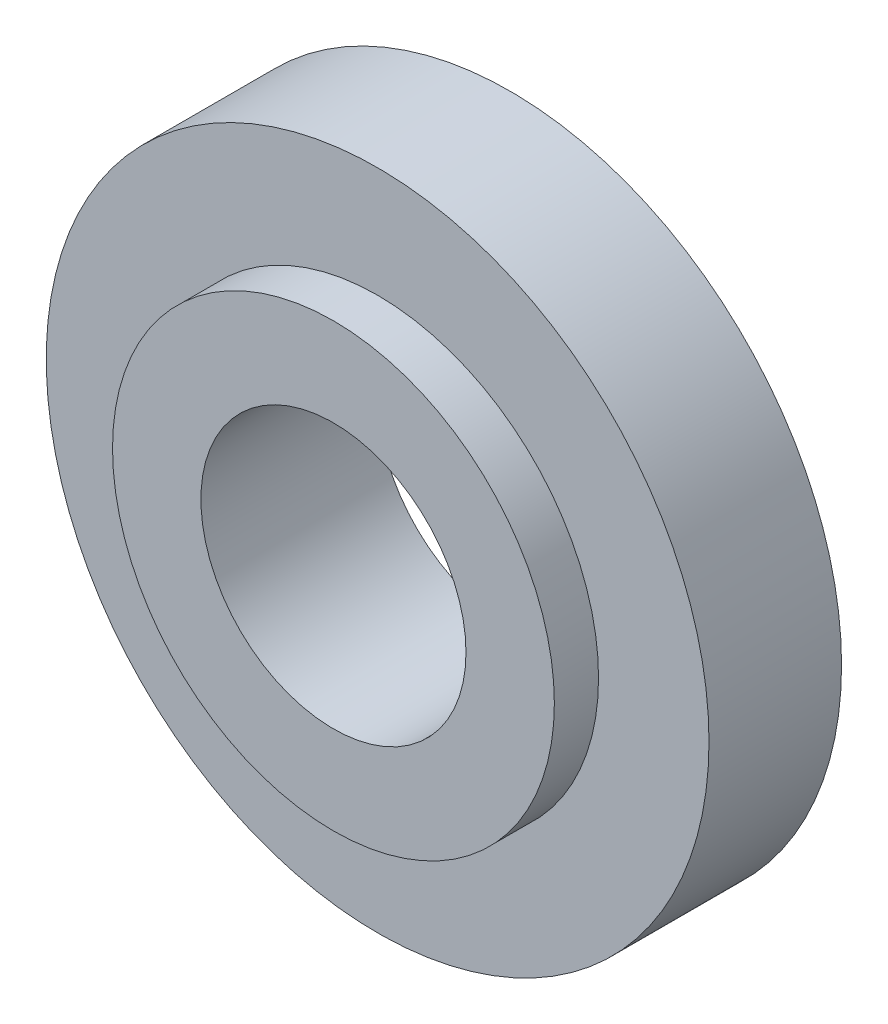
from build123d import *

# Parameters (mm, degrees)
ESQUISSE1_R             = 3.75
BOSS_EXTRU_1_DEPTH      = 1.5
ESQUISSE2_R             = 1.5
ENL_V_MAT_EXTRU_1_DEPTH = 6.511351921
BOSS_EXTRU_3_START      = 0.5
ESQUISSE4_R             = 2.5
ESQUISSE4_R_2           = 1.5
BOSS_EXTRU_3_DEPTH      = 0.5


with BuildPart() as part:
    # Esquisse1 → Boss.-Extru.1 (new body)
    with BuildSketch(Plane.XY):
        Circle(ESQUISSE1_R)
    extrude(amount=BOSS_EXTRU_1_DEPTH)

    # Esquisse2 → Enlèv. mat.-Extru.1 (cut, through all)
    with BuildSketch(Plane.XY.offset(1.5)):
        Circle(ESQUISSE2_R)
    extrude(amount=-ENL_V_MAT_EXTRU_1_DEPTH, mode=Mode.SUBTRACT)

    # Esquisse4 → Boss.-Extru.3 (add)
    with BuildSketch(Plane.XY.offset(1.5).offset(BOSS_EXTRU_3_START)):
        Circle(ESQUISSE4_R)
        Circle(ESQUISSE4_R_2, mode=Mode.SUBTRACT)
    extrude(amount=-BOSS_EXTRU_3_DEPTH)


solid = part.part
